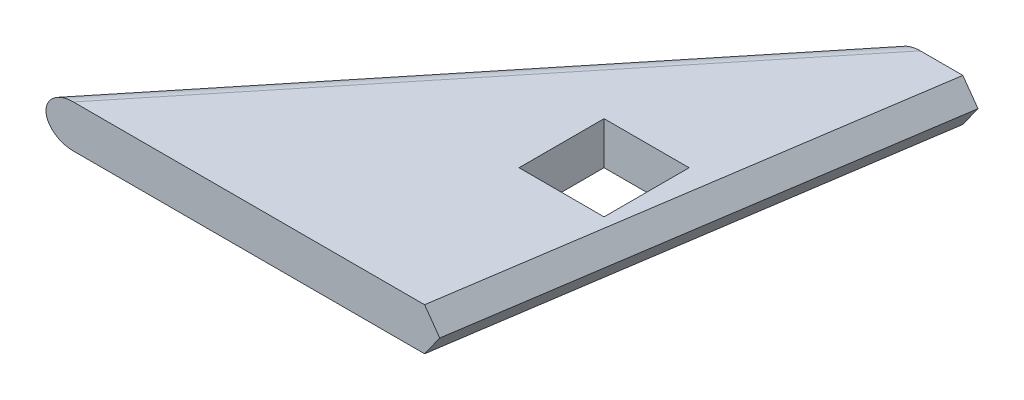
from build123d import *

# Parameters (mm, degrees)
BOSS_EXTRUDE1_DEPTH          = 12.7
SERVO_HOLE_DEPTH             = 224.084518592
SERVO_HOLE_DEPTH_BACK        = 224.084518592
SKETCH3_W                    = 25.4
SKETCH3_H                    = 25.4
FILLET1_R                    = 6.35
CUT_EXTRUDE1_DEPTH           = 224.084518592
CUT_EXTRUDE1_TAPER           = -7
CUT_EXTRUDE1_OTHER_WAY_DEPTH = 224.084518592


with BuildPart() as part:
    # Sketch1 → Boss-Extrude1 (new body)
    with BuildSketch(Plane(origin=(0, 0, 0), x_dir=(1, 0, 0), z_dir=(0, 1, 0))):
        Polygon((128.31424077, 139.7), (37.592, 0), (150.368, 0), (173.46274077, 139.7), align=None)
        Polygon((113.26474077, 139.7), (0, 0), (37.592, 0), (128.31424077, 139.7), align=None)
    extrude(amount=BOSS_EXTRUDE1_DEPTH)

    # Sketch3 → servo hole (cut, two sides: drawn at the far end of the back side and taken through both)
    with BuildSketch(Plane(origin=(0, 12.7, 0), x_dir=(1, 0, 0), z_dir=(0, 1, 0)).offset(-SERVO_HOLE_DEPTH_BACK)):
        with Locations((104.447870385, 62.23)):
            Rectangle(SKETCH3_W, SKETCH3_H)
    extrude(amount=SERVO_HOLE_DEPTH + SERVO_HOLE_DEPTH_BACK, mode=Mode.SUBTRACT)

    # Fillet1
    fillet1_edges = [part.edges().sort_by_distance(p)[0] for p in [
        (56.632370385, 0, -69.85),
        (56.632370385, 12.7, -69.85),
    ]]
    fillet(fillet1_edges, radius=FILLET1_R - 0.0001)  # a hair under: the kernel refuses the full size

    # Sketch4 → Cut-Extrude1 (cut)
    with BuildSketch(Plane(origin=(0, 0, -139.7), x_dir=(-1, 0, 0), z_dir=(0, 0, -1))):
        Polygon((-134.139610484, 0), (-138.66474077, 6.35), (-134.139610484, 12.7), (-173.46274077, 12.7), (-173.46274077, 0), align=None)
    extrude(amount=-CUT_EXTRUDE1_DEPTH, taper=CUT_EXTRUDE1_TAPER, mode=Mode.SUBTRACT)

    # Sketch4 → Cut-Extrude1 other way (cut)
    with BuildSketch(Plane(origin=(0, 0, -139.7), x_dir=(-1, 0, 0), z_dir=(0, 0, -1))):
        Polygon((-134.139610484, 0), (-138.66474077, 6.35), (-134.139610484, 12.7), (-173.46274077, 12.7), (-173.46274077, 0), align=None)
    extrude(amount=CUT_EXTRUDE1_OTHER_WAY_DEPTH, mode=Mode.SUBTRACT)


solid = part.part
